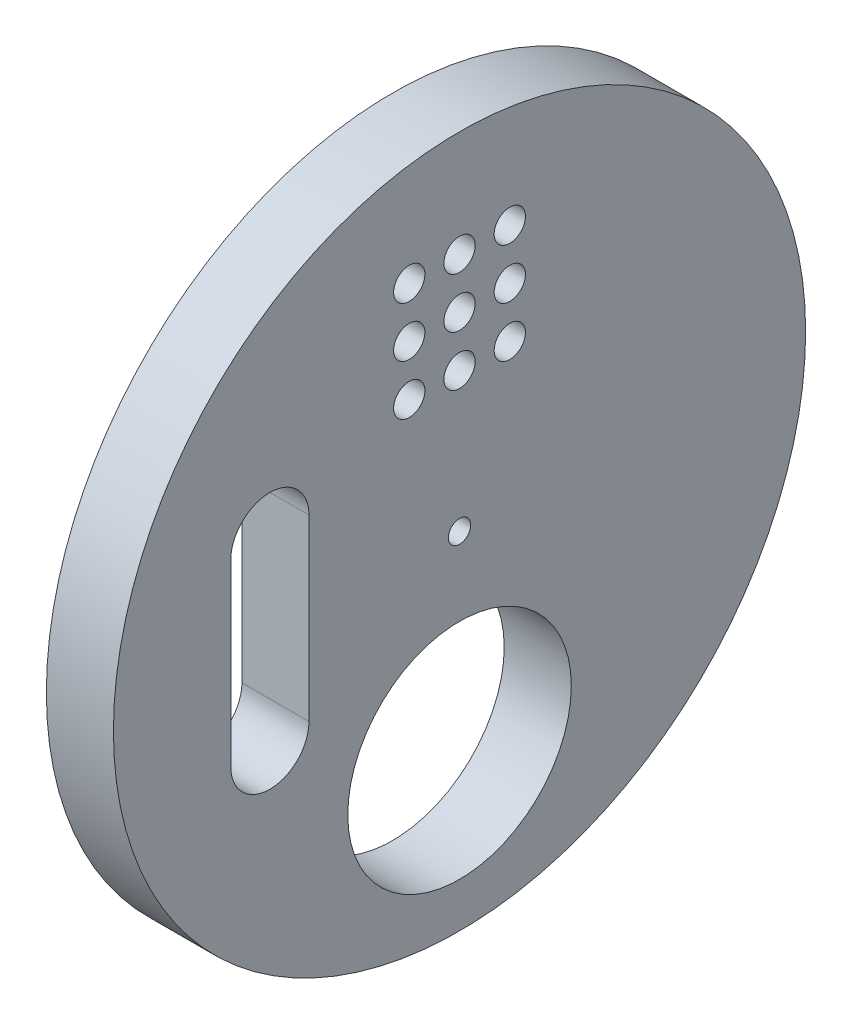
from build123d import *

# Parameters (mm, degrees)
SKETCH1_W           = 112.5
SKETCH1_H           = 238
BOSS_EXTRUDE1_DEPTH = 6
SKETCH2_R           = 30.970562748
SKETCH2_R_2         = 10
SKETCH2_R_3         = 1.4
SKETCH2_R_4         = 1
BOSS_EXTRUDE2_DEPTH = 6
SKETCH3_W           = 112.5
SKETCH3_H           = 238
CUT_EXTRUDE1_DEPTH  = 6


with BuildPart() as part:
    # Sketch1 → Boss-Extrude1 (new body)
    with BuildSketch(Plane(origin=(0, 0, 0), x_dir=(0, 0, -1), z_dir=(1, 0, 0))):
        Rectangle(SKETCH1_W, SKETCH1_H)
    extrude(amount=BOSS_EXTRUDE1_DEPTH)

    # Sketch2 → Boss-Extrude2 (add)
    with BuildSketch(Plane(origin=(6, 0, 0), x_dir=(0, 0, -1), z_dir=(1, 0, 0))):
        with Locations((0, -82.029437252)):
            Circle(SKETCH2_R)
        with Locations((0, -99)):
            Circle(SKETCH2_R_2, mode=Mode.SUBTRACT)
        with Locations((-4.5, -60.558874503)):
            Circle(SKETCH2_R_3, mode=Mode.SUBTRACT)
        with Locations((0, -60.558874503)):
            Circle(SKETCH2_R_3, mode=Mode.SUBTRACT)
        with Locations((4.5, -60.558874503)):
            Circle(SKETCH2_R_3, mode=Mode.SUBTRACT)
        with Locations((0, -65.058874503)):
            Circle(SKETCH2_R_3, mode=Mode.SUBTRACT)
        with Locations((4.5, -65.058874503)):
            Circle(SKETCH2_R_3, mode=Mode.SUBTRACT)
        with Locations((0, -69.558874503)):
            Circle(SKETCH2_R_3, mode=Mode.SUBTRACT)
        with Locations((4.5, -69.558874503)):
            Circle(SKETCH2_R_3, mode=Mode.SUBTRACT)
        with Locations((-4.5, -65.058874503)):
            Circle(SKETCH2_R_3, mode=Mode.SUBTRACT)
        with Locations((-4.5, -69.558874503)):
            Circle(SKETCH2_R_3, mode=Mode.SUBTRACT)
        with Locations((0, -82.029437252)):
            Circle(SKETCH2_R_4, mode=Mode.SUBTRACT)
        with BuildLine():
            Line((-13.470562748, -74.029437252), (-13.470562748, -90.029437252))
            ThreePointArc((-13.470562748, -90.029437252), (-16.970562748, -93.529437252), (-20.470562748, -90.029437252))
            Line((-20.470562748, -90.029437252), (-20.470562748, -74.029437252))
            ThreePointArc((-20.470562748, -74.029437252), (-16.970562748, -70.529437252), (-13.470562748, -74.029437252))
        make_face(mode=Mode.SUBTRACT)
    extrude(amount=BOSS_EXTRUDE2_DEPTH)

    # Sketch3 → Cut-Extrude1 (cut)
    with BuildSketch(Plane.ZY):
        Rectangle(SKETCH3_W, SKETCH3_H)
    extrude(amount=-CUT_EXTRUDE1_DEPTH, mode=Mode.SUBTRACT)


solid = part.part
